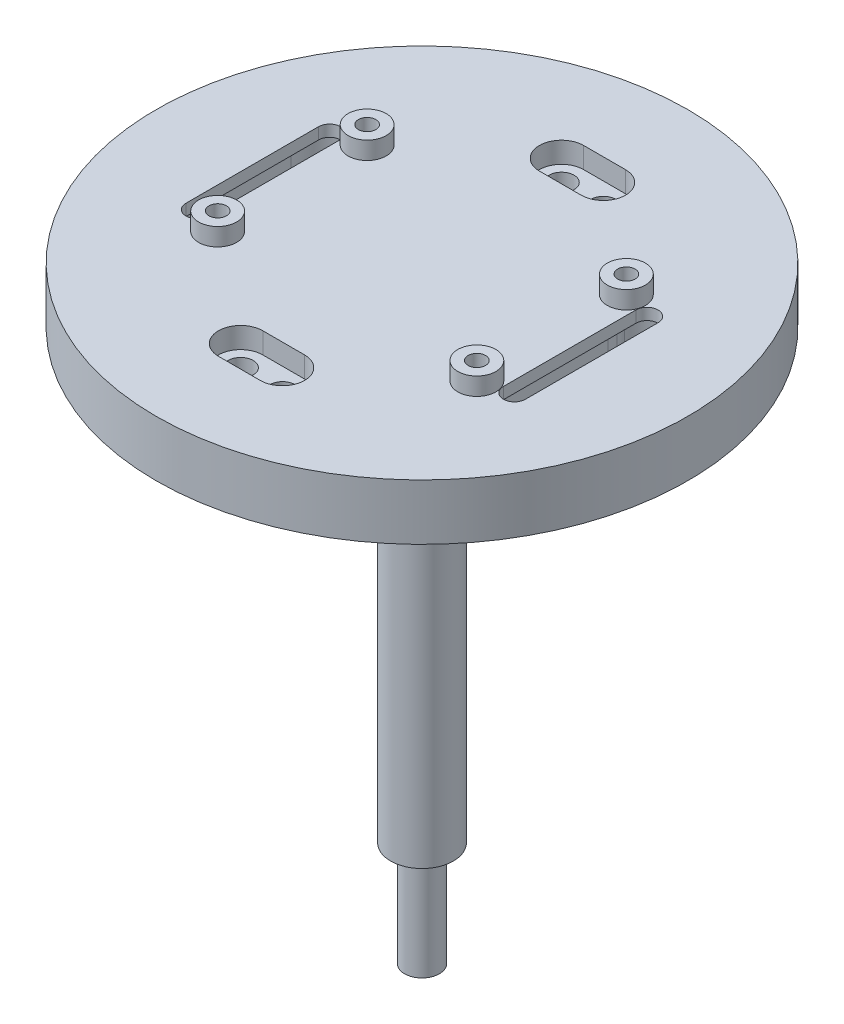
from build123d import *

# Parameters (mm, degrees)
CBORE_FOR_M3_SHCS1_D           = 3.6
CBORE_FOR_M3_SHCS1_CBORE_D     = 6.35
CBORE_FOR_M3_SHCS1_CBORE_DEPTH = 3
CUT_EXTRUDE1_DEPTH             = 100.795891637
CUT_EXTRUDE2_DEPTH             = 103.333865299
CUT_EXTRUDE3_DEPTH             = 6.35
SKETCH10_R                     = 2.7305
BOSS_EXTRUDE1_DEPTH            = 2.54
M3X0_5_TAPPED_HOLE1_D          = 2.5


with BuildPart() as part:
    # Sketch1 → Revolve1 (revolve)
    with BuildSketch(Plane.XY):
        Polygon((0, 86.999999926), (38.1, 86.999999926), (38.1, 78.999999926), (15, 78.999999926), (15, 79.999999926), (4.5, 79.999999926), (4.5, 15), (2.5, 15), (2.5, 0), (0, 0), align=None)
    revolve(axis=Axis((0, 0, 0), (0, 1, 0)))

    # CBORE for M3 SHCS1 (through all)
    with Locations(Plane(origin=(0, 86.999999926, 0), x_dir=(1, 0, 0), z_dir=(0, 1, 0))):
        with Locations((3, 23), (-3, 23), (-3, -23), (3, -23)):
            CounterBoreHole(CBORE_FOR_M3_SHCS1_D / 2, CBORE_FOR_M3_SHCS1_CBORE_D / 2, CBORE_FOR_M3_SHCS1_CBORE_DEPTH)

    # Sketch4 → Cut-Extrude1 (cut, through all)
    with BuildSketch(Plane(origin=(0, 83.999999926, 0), x_dir=(1, 0, 0), z_dir=(0, 1, 0))):
        with BuildLine():
            Line((-3, 26.175), (3, 26.175))
            ThreePointArc((3, 26.175), (6.175, 23), (3, 19.825))
            Line((3, 19.825), (-3, 19.825))
            ThreePointArc((-3, 19.825), (-6.175, 23), (-3, 26.175))
        make_face()
        with BuildLine():
            Line((-3, -19.825), (3, -19.825))
            ThreePointArc((3, -19.825), (6.175, -23), (3, -26.175))
            Line((3, -26.175), (-3, -26.175))
            ThreePointArc((-3, -26.175), (-6.175, -23), (-3, -19.825))
        make_face()
    extrude(amount=CUT_EXTRUDE1_DEPTH, mode=Mode.SUBTRACT)

    # Sketch5 → Cut-Extrude2 (cut, through all)
    with BuildSketch(Plane(origin=(0, 86.999999926, 0), x_dir=(1, 0, 0), z_dir=(0, 1, 0))):
        with BuildLine():
            Line((-24.3375, -9.5), (-24.3375, 9.5))
            ThreePointArc((-24.3375, 9.5), (-22.75, 11.0875), (-21.1625, 9.5))
            Line((-21.1625, 9.5), (-21.1625, -9.5))
            ThreePointArc((-21.1625, -9.5), (-22.75, -11.0875), (-24.3375, -9.5))
        make_face()
    cut_extrude2 = extrude(amount=-CUT_EXTRUDE2_DEPTH, mode=Mode.SUBTRACT)

    # Mirror1: Cut-Extrude2 across plane
    add(cut_extrude2.mirror(Plane(origin=(0, 0, 0), x_dir=(0, 0, 1), z_dir=(1, 0, 0))), mode=Mode.SUBTRACT)

    # Sketch7 → Cut-Extrude3 (cut)
    with BuildSketch(Plane.XZ.offset(-78.999999926)):
        with BuildLine():
            Line((28.30625, 9.5), (28.30625, -9.5))
            ThreePointArc((28.30625, -9.5), (22.75, -15.05625), (17.19375, -9.5))
            Line((17.19375, -9.5), (17.19375, 9.5))
            ThreePointArc((17.19375, 9.5), (22.75, 15.05625), (28.30625, 9.5))
        make_face()
        with BuildLine():
            Line((-17.19375, -9.5), (-17.19375, 9.5))
            ThreePointArc((-17.19375, 9.5), (-22.75, 15.05625), (-28.30625, 9.5))
            Line((-28.30625, 9.5), (-28.30625, -9.5))
            ThreePointArc((-28.30625, -9.5), (-22.75, -15.05625), (-17.19375, -9.5))
        make_face()
    extrude(amount=-CUT_EXTRUDE3_DEPTH, mode=Mode.SUBTRACT)

    # Sketch10 → Boss-Extrude1 (add)
    with BuildSketch(Plane(origin=(0, 86.999999926, 0), x_dir=(1, 0, 0), z_dir=(0, 1, 0))):
        with Locations((18.564426682, 10.731703917)):
            Circle(SKETCH10_R)
        with Locations((18.576605961, -10.711412891)):
            Circle(SKETCH10_R)
        with Locations((-18.563961822, -10.732508022)):
            Circle(SKETCH10_R)
        with Locations((-18.576141102, 10.710608786)):
            Circle(SKETCH10_R)
    extrude(amount=BOSS_EXTRUDE1_DEPTH)

    # M3x0.5 Tapped Hole1 (through all)
    with Locations(Plane(origin=(0, 89.539999926, 0), x_dir=(1, 0, 0), z_dir=(0, 1, 0))):
        with Locations((-18.576141102, 10.710608786), (18.564426682, 10.731703917), (18.576605961, -10.711412891), (-18.576141102, -10.711412891)):
            Hole(M3X0_5_TAPPED_HOLE1_D / 2)


solid = part.part
